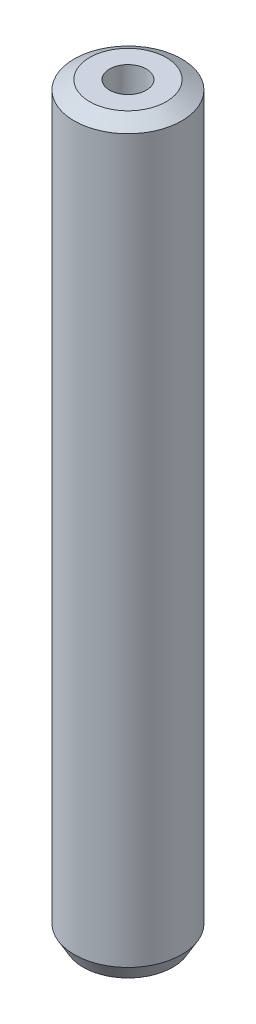
from build123d import *
from OCP.BRepFilletAPI import BRepFilletAPI_MakeChamfer

# Parameters (mm, degrees)
SKETCH1_R           = 15
BOSS_EXTRUDE1_DEPTH = 208.281163662
SKETCH2_R           = 5.127797197
CUT_EXTRUDE1_DEPTH  = 210.35864715
CHAMFER1_SIZE       = 2.491493616
CHAMFER1_SIZE2      = 4.31539353


with BuildPart() as part:
    # Sketch1 → Boss-Extrude1 (new body)
    with BuildSketch(Plane(origin=(0, 0, 0), x_dir=(1, 0, 0), z_dir=(0, 1, 0))):
        Circle(SKETCH1_R)
    extrude(amount=BOSS_EXTRUDE1_DEPTH)

    # Sketch2 → Cut-Extrude1 (cut, through all)
    with BuildSketch(Plane(origin=(0, 0, 0), x_dir=(1, 0, 0), z_dir=(0, 1, 0))):
        Circle(SKETCH2_R)
    extrude(amount=CUT_EXTRUDE1_DEPTH, mode=Mode.SUBTRACT)

    # Chamfer1: one chamfer whose edges measure the first distance from different faces: ONE call of the kernel's chamfer builder (chamfer() names one face for all edges)
    chamfer1_edges_1 = [part.edges().sort_by_distance(p)[0] for p in [
        (-15, 208.281163662, 0),
    ]]
    chamfer1_side_1 = [part.faces().sort_by_distance(p)[0] for p in [
        (-15, 104.140581831, 0),
    ]]
    chamfer1_edges_2 = [part.edges().sort_by_distance(p)[0] for p in [
        (-15, 0, 0),
    ]]
    chamfer1_side_2 = [part.faces().sort_by_distance(p)[0] for p in [
        (-14.575735931, 0, 0),
    ]]
    chamfer1 = BRepFilletAPI_MakeChamfer(part.part.solid().wrapped)
    for e in chamfer1_edges_1:
        chamfer1.Add(CHAMFER1_SIZE, CHAMFER1_SIZE2, e.wrapped, chamfer1_side_1[0].wrapped)  # the first distance lies on this face
    for e in chamfer1_edges_2:
        chamfer1.Add(CHAMFER1_SIZE, CHAMFER1_SIZE2, e.wrapped, chamfer1_side_2[0].wrapped)  # the first distance lies on this face
    add(Compound.cast(chamfer1.Shape()), mode=Mode.REPLACE)


solid = part.part
